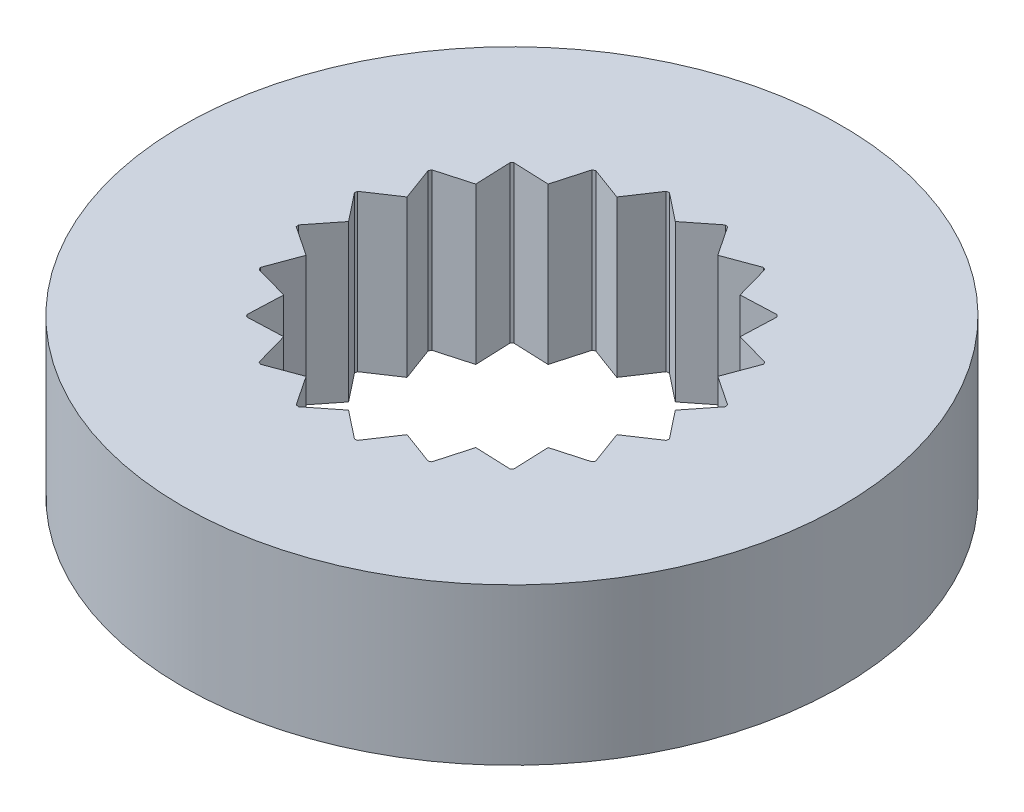
from build123d import *

# Parameters (mm, degrees)
SKETCH3_R           = 4.64
SKETCH3_R_2         = 2.64
BOSS_EXTRUDE2_DEPTH = 2.2
BOSS_EXTRUDE3_DEPTH = 2.2
CIRPATTERN2_COUNT   = 20


with BuildPart() as part:
    # Sketch3 → Boss-Extrude2 (new body)
    with BuildSketch(Plane(origin=(0, 0, 0), x_dir=(1, 0, 0), z_dir=(0, 1, 0))):
        Circle(SKETCH3_R)
        Circle(SKETCH3_R_2, mode=Mode.SUBTRACT)
    extrude(amount=BOSS_EXTRUDE2_DEPTH)

    # Sketch4 → Boss-Extrude3 (add)
    with BuildSketch(Plane(origin=(0, 0, 0), x_dir=(1, 0, 0), z_dir=(0, 1, 0))):
        Polygon((0, 2.3), (-0.852803128, 2.973265628), (0.852803128, 2.973265628), align=None)
    boss_extrude3 = extrude(amount=BOSS_EXTRUDE3_DEPTH)

    # CirPattern2: Boss-Extrude3 ×20 about axis
    cirpattern2_axis = Axis((0, 2.2, 0), (0, 1, 0))
    for i in range(1, CIRPATTERN2_COUNT):
        add(boss_extrude3.rotate(cirpattern2_axis, i * 360 / CIRPATTERN2_COUNT))


solid = part.part
